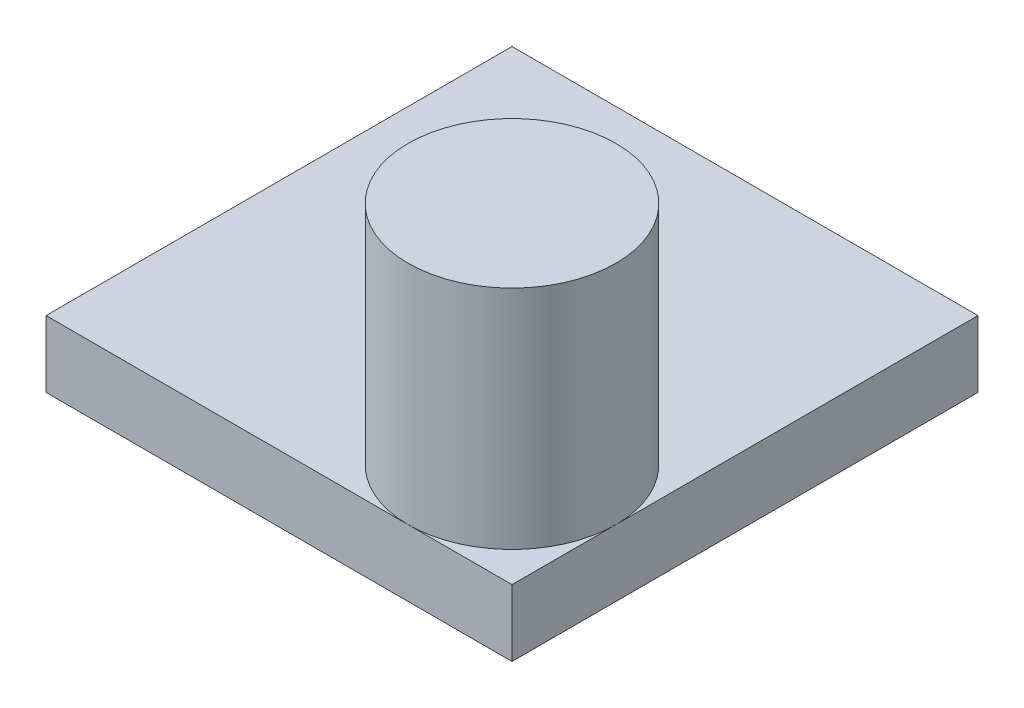
from build123d import *

# Parameters (mm, degrees)
SKETCH1_R           = 15.600223339
BOSS_EXTRUDE1_DEPTH = 34
SKETCH2_W           = 70
SKETCH2_H           = 70
BOSS_EXTRUDE2_DEPTH = 10


with BuildPart() as part:
    # Sketch1 → Boss-Extrude1 (new body)
    with BuildSketch(Plane(origin=(0, 0, 0), x_dir=(1, 0, 0), z_dir=(0, 1, 0))):
        Circle(SKETCH1_R)
    extrude(amount=BOSS_EXTRUDE1_DEPTH)

    # Sketch2 → Boss-Extrude2 (add)
    with BuildSketch(Plane.XZ):
        with Locations((-19.399776661, -19.399776661)):
            Rectangle(SKETCH2_W, SKETCH2_H)
    extrude(amount=BOSS_EXTRUDE2_DEPTH)


solid = part.part
